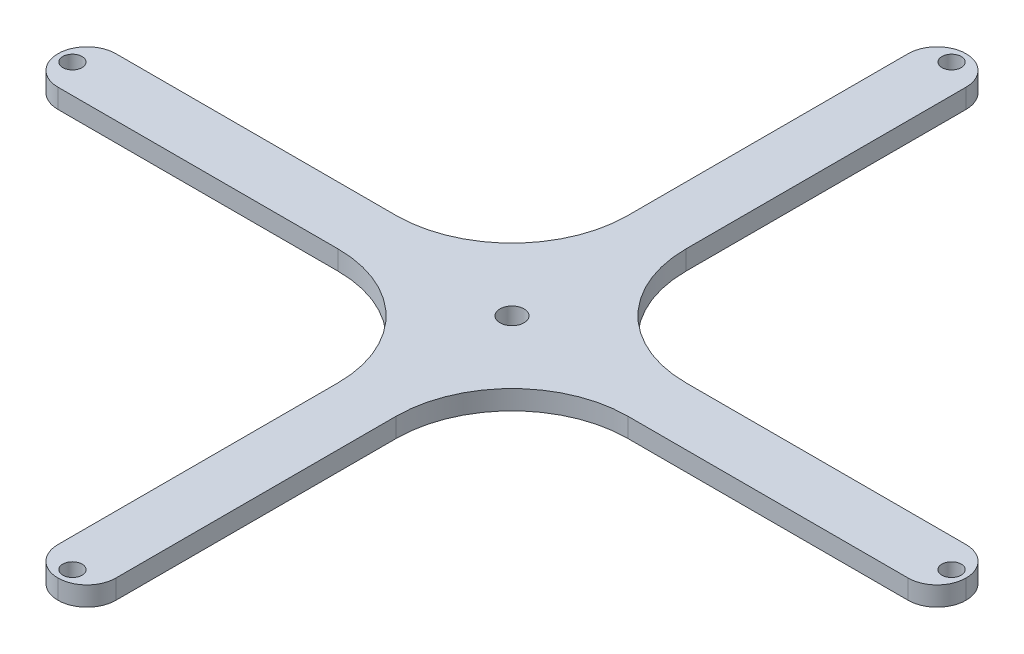
from build123d import *

# Parameters (mm, degrees)
SKETCH2_R           = 3.175
SKETCH2_R_2         = 3.96875
BOSS_EXTRUDE1_DEPTH = 6.35
FILLET1_R           = 9.525
FILLET3_R           = 38.1


with BuildPart() as part:
    # Sketch2 → Boss-Extrude1 (new body)
    with BuildSketch(Plane(origin=(0, 0, 0), x_dir=(1, 0, 0), z_dir=(0, 1, 0))):
        with BuildLine():
            ThreePointArc((-148.920700374, 9.525), (-149.225, 0), (-148.920700374, -9.525))
            Line((-148.920700374, -9.525), (-9.525, -9.525))
            Line((-9.525, -9.525), (-9.525, -148.920700374))
            ThreePointArc((-9.525, -148.920700374), (0, -149.225), (9.525, -148.920700374))
            Line((9.525, -148.920700374), (9.525, -9.525))
            Line((9.525, -9.525), (148.920700374, -9.525))
            ThreePointArc((148.920700374, -9.525), (149.148905692, -4.764929781), (149.225, 0))
            ThreePointArc((149.225, 0), (149.148905692, 4.764929781), (148.920700374, 9.525))
            Line((148.920700374, 9.525), (9.525, 9.525))
            Line((9.525, 9.525), (9.525, 148.920700374))
            ThreePointArc((9.525, 148.920700374), (0, 149.225), (-9.525, 148.920700374))
            Line((-9.525, 148.920700374), (-9.525, 9.525))
            Line((-9.525, 9.525), (-148.920700374, 9.525))
        make_face()
        with Locations(Location((-144.4625, 0, 0), (0, 0, 270))):
            Circle(SKETCH2_R, mode=Mode.SUBTRACT)
        with Locations(Location((0, -144.4625, 0), (0, 0, 270))):
            Circle(SKETCH2_R, mode=Mode.SUBTRACT)
        with Locations(Location((144.4625, 0, 0), (0, 0, 270))):
            Circle(SKETCH2_R, mode=Mode.SUBTRACT)
        with Locations(Location((0, 144.4625, 0), (0, 0, 270))):
            Circle(SKETCH2_R, mode=Mode.SUBTRACT)
        with Locations(Location((0, 0, 0), (0, 0, 270))):
            Circle(SKETCH2_R_2, mode=Mode.SUBTRACT)
    extrude(amount=BOSS_EXTRUDE1_DEPTH)

    # Fillet1
    fillet1_edges = [part.edges().sort_by_distance(p)[0] for p in [
        (-9.525, 3.175, -148.920700374),
        (9.525, 3.175, -148.920700374),
        (148.920700374, 3.175, -9.525),
        (148.920700374, 3.175, 9.525),
        (9.525, 3.175, 148.920700374),
        (-9.525, 3.175, 148.920700374),
        (-148.920700374, 3.175, -9.525),
        (-148.920700374, 3.175, 9.525),
    ]]
    fillet(fillet1_edges, radius=FILLET1_R - 0.0001)  # a hair under: the kernel refuses the full size

    # Fillet3
    fillet3_edges = [part.edges().sort_by_distance(p)[0] for p in [
        (9.525, 3.175, 9.525),
        (-9.525, 3.175, 9.525),
        (-9.525, 3.175, -9.525),
        (9.525, 3.175, -9.525),
    ]]
    fillet(fillet3_edges, radius=FILLET3_R)


solid = part.part
